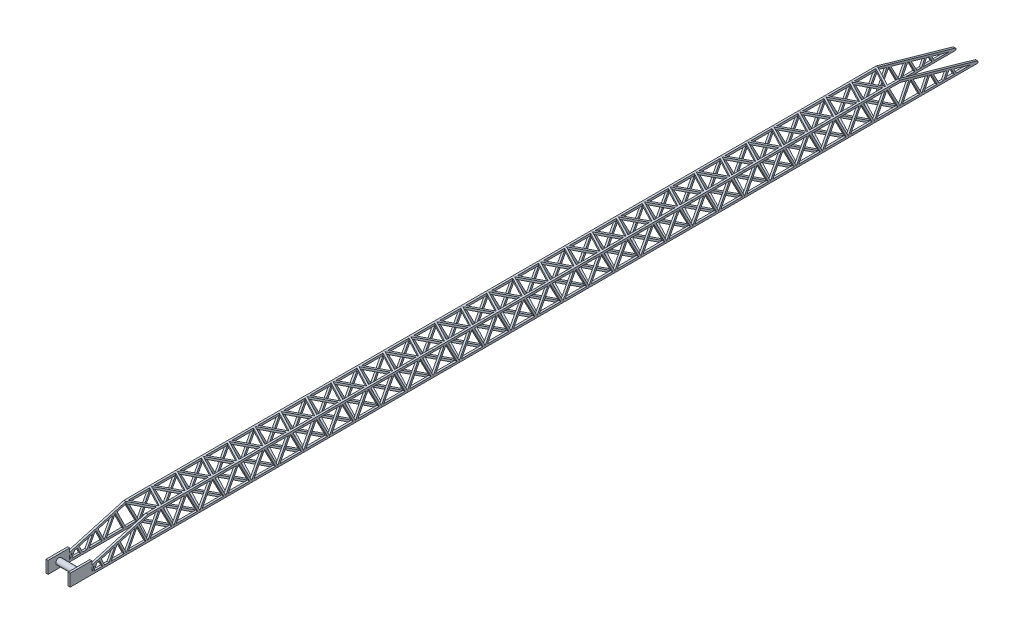
from build123d import *

# Parameters (mm, degrees)
SKETCH1_W             = 120
SKETCH1_H             = 120
BOSS_EXTRUDE1_DEPTH   = 1500
BOSS_EXTRUDE1_2_DEPTH = 1500
BOSS_EXTRUDE1_3_DEPTH = 1500
BOSS_EXTRUDE1_4_DEPTH = 1500
SKETCH2_W             = 120
SKETCH2_H             = 120
BOSS_EXTRUDE2_DEPTH   = 1310.610544746
CIRPATTERN1_COUNT     = 2
CIRPATTERN3_COUNT     = 2
LPATTERN1_COUNT       = 28
LPATTERN1_PITCH       = 1500
SKETCH4_W             = 120
SKETCH4_H             = 120
BOSS_EXTRUDE3_DEPTH   = 4500
LOFT4_START           = 580
LOFT4_DEPTH           = 120
LPATTERN2_COUNT       = 3
LPATTERN2_PITCH       = 1250
LPATTERN2_COUNT_DIR2  = 2
LPATTERN2_PITCH_DIR2  = 1280
LPATTERN3_COUNT       = 3
LPATTERN3_PITCH       = 1000
LPATTERN3_COUNT_DIR2  = 2
LPATTERN3_PITCH_DIR2  = 1280
SURFACECUT3_START     = -700
SURFACECUT3_DEPTH     = 1400
SKETCH10_W            = 1250
SKETCH10_H            = 700
BOSS_EXTRUDE4_DEPTH   = 120
SKETCH11_R            = 175
BOSS_EXTRUDE5_DEPTH   = 580
FILLET1_R             = 50


with BuildPart() as part:
    # Sketch1 → Boss-Extrude1 (new body)
    with BuildSketch(Plane.XY):
        with Locations((-640, -640)):
            Rectangle(SKETCH1_W, SKETCH1_H)
    extrude(amount=BOSS_EXTRUDE1_DEPTH)


with BuildPart() as body_2:
    # Sketch1 → Boss-Extrude1 2 (new body)
    with BuildSketch(Plane.XY):
        with Locations((640, -640)):
            Rectangle(SKETCH1_W, SKETCH1_H)
    extrude(amount=BOSS_EXTRUDE1_2_DEPTH)

    # Sketch2 → Boss-Extrude2 (add, along a direction that is not the sketch's normal)
    with BuildSketch(Plane.ZY.offset(-580)):
        with Locations((70, -640)):
            Rectangle(SKETCH2_W, SKETCH2_H)
    boss_extrude2 = extrude(amount=BOSS_EXTRUDE2_DEPTH, dir=(-0.8850836769550111, 0, 0.4654319335711696))

    # Mirror1: Boss-Extrude2 across plane
    add(boss_extrude2.mirror(Plane.XY.offset(750)))


with BuildPart() as body_3:
    # Sketch1 → Boss-Extrude1 3 (new body)
    with BuildSketch(Plane.XY):
        with Locations((-640, 640)):
            Rectangle(SKETCH1_W, SKETCH1_H)
    extrude(amount=BOSS_EXTRUDE1_3_DEPTH)


with BuildPart() as body_4:
    # Sketch1 → Boss-Extrude1 4 (new body)
    with BuildSketch(Plane.XY):
        with Locations((640, 640)):
            Rectangle(SKETCH1_W, SKETCH1_H)
    extrude(amount=BOSS_EXTRUDE1_4_DEPTH)


with BuildPart() as cirpattern1_1:
    # CirPattern1: pattern copy
    add(body_2.part.rotate(Axis((0, 0, 0), (0, 0, 1)), 1 * 360 / CIRPATTERN1_COUNT))


with BuildPart() as body_6:
    # Mirror4: mirrored copy
    add(body_2.part.mirror(Plane(origin=(0, 0, 0), x_dir=(0, 0, 1), z_dir=(0.7071067811865477, 0.7071067811865475, 0))))


with BuildPart() as cirpattern3_1:
    # CirPattern3: pattern copy
    add(body_6.part.rotate(Axis((0, 0, 0), (0, 0, 1)), 1 * 360 / CIRPATTERN3_COUNT))


with BuildPart() as cirpattern1_1_1:
    add(cirpattern1_1.part)

    # Combine1: union body 2, body 3, body 6, part, body 4, CirPattern3_1
    add(body_2.part)
    add(body_3.part)
    add(body_6.part)
    add(part.part)
    add(body_4.part)
    add(cirpattern3_1.part)


with BuildPart() as lpattern1_1:
    # LPattern1: pattern copy
    add(cirpattern1_1_1.part.moved(Location(Vector(0, 0, 1) * (1 * LPATTERN1_PITCH))))


with BuildPart() as lpattern1_2:
    # LPattern1: pattern copy
    add(cirpattern1_1_1.part.moved(Location(Vector(0, 0, 1) * (2 * LPATTERN1_PITCH))))


with BuildPart() as lpattern1_3:
    # LPattern1: pattern copy
    add(cirpattern1_1_1.part.moved(Location(Vector(0, 0, 1) * (3 * LPATTERN1_PITCH))))


with BuildPart() as lpattern1_4:
    # LPattern1: pattern copy
    add(cirpattern1_1_1.part.moved(Location(Vector(0, 0, 1) * (4 * LPATTERN1_PITCH))))


with BuildPart() as lpattern1_5:
    # LPattern1: pattern copy
    add(cirpattern1_1_1.part.moved(Location(Vector(0, 0, 1) * (5 * LPATTERN1_PITCH))))


with BuildPart() as lpattern1_6:
    # LPattern1: pattern copy
    add(cirpattern1_1_1.part.moved(Location(Vector(0, 0, 1) * (6 * LPATTERN1_PITCH))))


with BuildPart() as lpattern1_7:
    # LPattern1: pattern copy
    add(cirpattern1_1_1.part.moved(Location(Vector(0, 0, 1) * (7 * LPATTERN1_PITCH))))


with BuildPart() as lpattern1_8:
    # LPattern1: pattern copy
    add(cirpattern1_1_1.part.moved(Location(Vector(0, 0, 1) * (8 * LPATTERN1_PITCH))))


with BuildPart() as lpattern1_9:
    # LPattern1: pattern copy
    add(cirpattern1_1_1.part.moved(Location(Vector(0, 0, 1) * (9 * LPATTERN1_PITCH))))


with BuildPart() as lpattern1_10:
    # LPattern1: pattern copy
    add(cirpattern1_1_1.part.moved(Location(Vector(0, 0, 1) * (10 * LPATTERN1_PITCH))))


with BuildPart() as lpattern1_11:
    # LPattern1: pattern copy
    add(cirpattern1_1_1.part.moved(Location(Vector(0, 0, 1) * (11 * LPATTERN1_PITCH))))


with BuildPart() as lpattern1_12:
    # LPattern1: pattern copy
    add(cirpattern1_1_1.part.moved(Location(Vector(0, 0, 1) * (12 * LPATTERN1_PITCH))))


with BuildPart() as lpattern1_13:
    # LPattern1: pattern copy
    add(cirpattern1_1_1.part.moved(Location(Vector(0, 0, 1) * (13 * LPATTERN1_PITCH))))


with BuildPart() as lpattern1_14:
    # LPattern1: pattern copy
    add(cirpattern1_1_1.part.moved(Location(Vector(0, 0, 1) * (14 * LPATTERN1_PITCH))))


with BuildPart() as lpattern1_15:
    # LPattern1: pattern copy
    add(cirpattern1_1_1.part.moved(Location(Vector(0, 0, 1) * (15 * LPATTERN1_PITCH))))


with BuildPart() as lpattern1_16:
    # LPattern1: pattern copy
    add(cirpattern1_1_1.part.moved(Location(Vector(0, 0, 1) * (16 * LPATTERN1_PITCH))))


with BuildPart() as lpattern1_17:
    # LPattern1: pattern copy
    add(cirpattern1_1_1.part.moved(Location(Vector(0, 0, 1) * (17 * LPATTERN1_PITCH))))


with BuildPart() as lpattern1_18:
    # LPattern1: pattern copy
    add(cirpattern1_1_1.part.moved(Location(Vector(0, 0, 1) * (18 * LPATTERN1_PITCH))))


with BuildPart() as lpattern1_19:
    # LPattern1: pattern copy
    add(cirpattern1_1_1.part.moved(Location(Vector(0, 0, 1) * (19 * LPATTERN1_PITCH))))


with BuildPart() as lpattern1_20:
    # LPattern1: pattern copy
    add(cirpattern1_1_1.part.moved(Location(Vector(0, 0, 1) * (20 * LPATTERN1_PITCH))))


with BuildPart() as lpattern1_21:
    # LPattern1: pattern copy
    add(cirpattern1_1_1.part.moved(Location(Vector(0, 0, 1) * (21 * LPATTERN1_PITCH))))


with BuildPart() as lpattern1_22:
    # LPattern1: pattern copy
    add(cirpattern1_1_1.part.moved(Location(Vector(0, 0, 1) * (22 * LPATTERN1_PITCH))))


with BuildPart() as lpattern1_23:
    # LPattern1: pattern copy
    add(cirpattern1_1_1.part.moved(Location(Vector(0, 0, 1) * (23 * LPATTERN1_PITCH))))


with BuildPart() as lpattern1_24:
    # LPattern1: pattern copy
    add(cirpattern1_1_1.part.moved(Location(Vector(0, 0, 1) * (24 * LPATTERN1_PITCH))))


with BuildPart() as lpattern1_25:
    # LPattern1: pattern copy
    add(cirpattern1_1_1.part.moved(Location(Vector(0, 0, 1) * (25 * LPATTERN1_PITCH))))


with BuildPart() as lpattern1_26:
    # LPattern1: pattern copy
    add(cirpattern1_1_1.part.moved(Location(Vector(0, 0, 1) * (26 * LPATTERN1_PITCH))))


with BuildPart() as lpattern1_27:
    # LPattern1: pattern copy
    add(cirpattern1_1_1.part.moved(Location(Vector(0, 0, 1) * (27 * LPATTERN1_PITCH))))


with BuildPart() as cirpattern1_1_2:
    add(cirpattern1_1_1.part)

    # Sketch4 → Boss-Extrude3 (add)
    with BuildSketch(Plane(origin=(0, 0, 0), x_dir=(-1, 0, 0), z_dir=(0, 0, -1))):
        with Locations((-640, -640)):
            Rectangle(SKETCH4_W, SKETCH4_H)
        with Locations((640, -640)):
            Rectangle(SKETCH4_W, SKETCH4_H)
    extrude(amount=BOSS_EXTRUDE3_DEPTH)

    # loft from a face of the part (loft5)
    loft([cirpattern1_1_2.faces().sort_by_distance((-640, 640, 0))[0], cirpattern1_1_2.faces().sort_by_distance((-640, -640, -4500))[0]])



with BuildPart() as body_29:
    # Loft4: read off the stored shape, not the designer's step
    # Loft4 outline → Loft4 (new body)
    with BuildSketch(Plane.YZ.offset(LOFT4_START)):
        Polygon((580, 0), (-700, -4500), (-580, -4500), (700, 0), align=None)
    extrude(amount=LOFT4_DEPTH)


with BuildPart() as cirpattern1_1_3:
    add(cirpattern1_1_2.part)

    add(body_29.part)  # Loft6 merges body 29
    # Sketch6 → Loft6 section 0
    with BuildSketch(Plane(origin=(0, 536.585588714, -152.628789679), x_dir=(1, 0, 0), z_dir=(0, -0.9618459163232355, 0.273591727309719))):
        with BuildLine():
            Line((700, -363.723170962), (580, -363.723170962))
            Line((580, -363.723170962), (580, -483.723170962))
            Line((580, -483.723170962), (700, -483.723170962))
            Line((700, -483.723170962), (700, -363.723170962))
        make_face()
    # Sketch5 → Loft6 section 1
    with BuildSketch(Plane(origin=(0, -580, 0), x_dir=(1, 0, 0), z_dir=(0, 1, 0))):
        with BuildLine():
            Line((580, 10), (700, 10))
            Line((700, 10), (700, 130))
            Line((700, 130), (580, 130))
            Line((580, 130), (580, 10))
        make_face()
    loft6 = loft()

    # LPattern2: Loft6 3 × 2
    with Locations(*[(-j * LPATTERN2_PITCH_DIR2, 0, -i * LPATTERN2_PITCH) for i in range(LPATTERN2_COUNT) for j in range(LPATTERN2_COUNT_DIR2) if (i, j) != (0, 0)]):
        add(loft6)

    # Sketch8 → Loft7 section 0
    with BuildSketch(Plane(origin=(0, 536.585588714, -152.628789679), x_dir=(1, 0, 0), z_dir=(0, -0.9618459163232354, 0.2735917273097189))):
        with BuildLine():
            Line((700, -493.723170962), (580, -493.723170962))
            Line((580, -493.723170962), (580, -613.723170962))
            Line((580, -613.723170962), (700, -613.723170962))
            Line((700, -613.723170962), (700, -493.723170962))
        make_face()
    # Sketch7 → Loft7 section 1
    with BuildSketch(Plane(origin=(0, -580, 0), x_dir=(1, 0, 0), z_dir=(0, 1, 0))):
        with BuildLine():
            Line((580, 1130), (700, 1130))
            Line((700, 1130), (700, 1250))
            Line((700, 1250), (580, 1250))
            Line((580, 1250), (580, 1130))
        make_face()
    loft7 = loft()

    # LPattern3: Loft7 3 × 2
    with Locations(*[(-j * LPATTERN3_PITCH_DIR2, 0, -i * LPATTERN3_PITCH) for i in range(LPATTERN3_COUNT) for j in range(LPATTERN3_COUNT_DIR2) if (i, j) != (0, 0)]):
        add(loft7)

    # SurfaceCut3: read off the stored shape, not the designer's step
    # SurfaceCut3 outline → SurfaceCut3 (cut)
    with BuildSketch(Plane.YZ.offset(SURFACECUT3_START)):
        Polygon((-82.479118308, -2750.903150301), (-113.820666607, -2861.088281039), (-83.800870503, -2875.969299098), (-123.891589205, -2896.4938683), (-160.695687832, -3025.883277534), (21.822892196, -2928.327720012), (404.242930831, -3117.895946299), (437.073938108, -3002.47443634), (146.413383497, -2861.734528026), (368.67600628, -2742.935915421), (401.507013557, -2627.514405462), (42.38982069, -2811.365578886), align=None)
        Polygon((230.033998333, -1652.22422461), (174.747761903, -1846.589899561), (264.493413243, -1798.621155501), (404.242930831, -1867.895946299), (437.073938108, -1752.47443634), (374.57131478, -1722.210221478), (401.507013557, -1627.514405462), (293.353458065, -1682.88395747), align=None)
    extrude(amount=SURFACECUT3_DEPTH, mode=Mode.SUBTRACT)


with BuildPart() as body_29_2:
    # Mirror10: mirrored copy
    add(cirpattern1_1_3.part.mirror(Plane(origin=(0, 0, 21750), x_dir=(1, 0, 0), z_dir=(0, 0, -1))))

    # Sketch10 → Boss-Extrude4 (add)
    with BuildSketch(Plane(origin=(700, 0, 0), x_dir=(0, 0, -1), z_dir=(1, 0, 0))):
        with Locations((-47375, -350)):
            Rectangle(SKETCH10_W, SKETCH10_H)
    boss_extrude4 = extrude(amount=-BOSS_EXTRUDE4_DEPTH)

    # Sketch11 → Boss-Extrude5 (add)
    with BuildSketch(Plane.ZY.offset(-580)):
        with Locations(Location((47375, -350, 0), (0, 0, 180))):
            Circle(SKETCH11_R)
    boss_extrude5 = extrude(amount=BOSS_EXTRUDE5_DEPTH)

    # Mirror11: Boss-Extrude4, Boss-Extrude5 across plane
    add(boss_extrude4.mirror(Plane(origin=(0, 0, 0), x_dir=(0, 0, 1), z_dir=(1, 0, 0))))
    add(boss_extrude5.mirror(Plane(origin=(0, 0, 0), x_dir=(0, 0, 1), z_dir=(1, 0, 0))))


with BuildPart() as cirpattern1_1_4:
    add(cirpattern1_1_3.part)

    # Fillet1
    fillet1_edges = [cirpattern1_1_4.edges().sort_by_distance(p)[0] for p in [
        (640, -700, -4500),
        (640, -580, -4500),
        (-640, -580, -4500),
        (-640, -700, -4500),
    ]]
    fillet(fillet1_edges, radius=FILLET1_R)


solid = Compound([lpattern1_1.part, lpattern1_2.part, lpattern1_3.part, lpattern1_4.part, lpattern1_5.part, lpattern1_6.part, lpattern1_7.part, lpattern1_8.part, lpattern1_9.part, lpattern1_10.part, lpattern1_11.part, lpattern1_12.part, lpattern1_13.part, lpattern1_14.part, lpattern1_15.part, lpattern1_16.part, lpattern1_17.part, lpattern1_18.part, lpattern1_19.part, lpattern1_20.part, lpattern1_21.part, lpattern1_22.part, lpattern1_23.part, lpattern1_24.part, lpattern1_25.part, lpattern1_26.part, lpattern1_27.part, body_29_2.part, cirpattern1_1_4.part])
